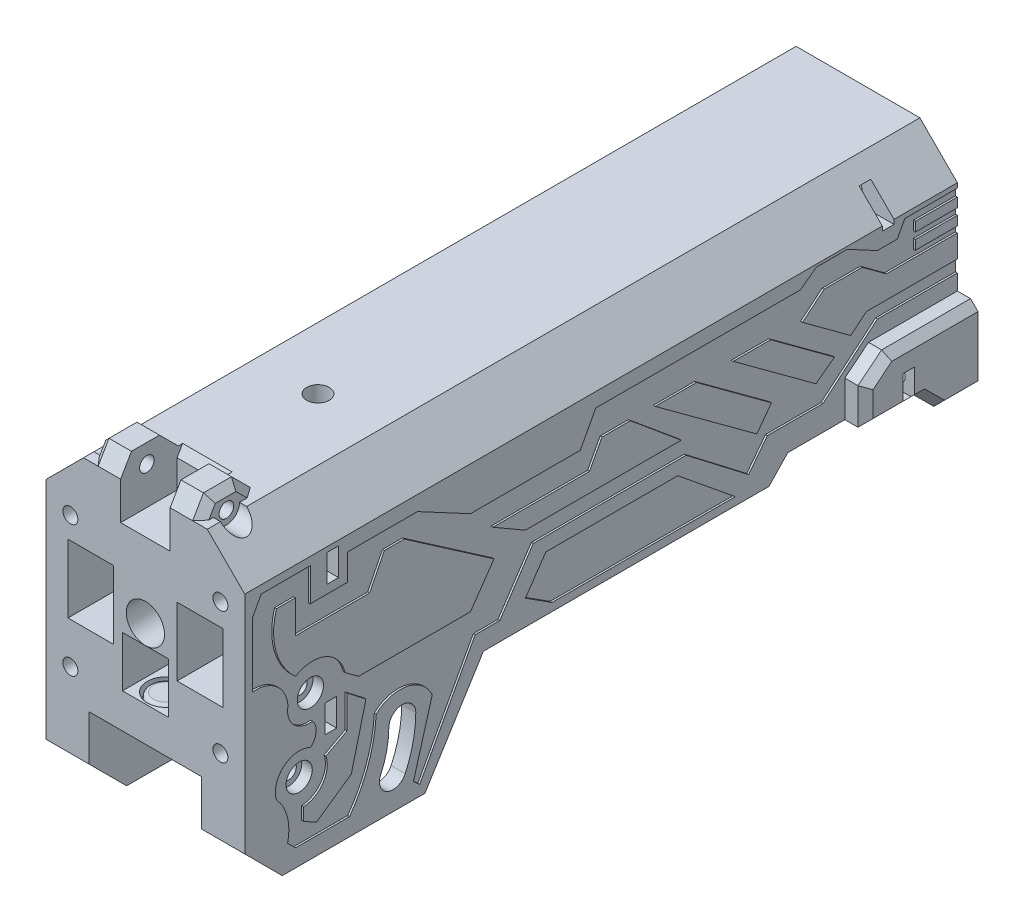
from build123d import *

# Parameters (mm, degrees)
EXTRUDE_2_DEPTH            = 26.5
SKETCH_6_R                 = 22.575
CUT_EXTRUDE_4_DEPTH        = 160
SKETCH_4_W                 = 160
SKETCH_4_H                 = 60
CUT_EXTRUDE_2_DEPTH        = 22.75
CUT_EXTRUDE_5_DEPTH        = 208.851509497
CUT_EXTRUDE_5_DEPTH_BACK   = 208.851509497
SKETCH_7_R                 = 2.05
CUT_EXTRUDE_6_DEPTH        = 15
CUT_EXTRUDE_8_REACH        = 214.859
CHAMFER_1_SIZE             = 10
CHAMFER_2_SIZE             = 10
CUT_EXTRUDE_15_DEPTH       = 208.851509497
CUT_EXTRUDE_15_DEPTH_BACK  = 208.851509497
SKETCH_18_R                = 1.95
CUT_EXTRUDE_14_DEPTH       = 6.1
SKETCH_19_R                = 5
SKETCH_19_R_2              = 4.3
CUT_EXTRUDE_16_DEPTH       = 3.5
FILLET_1_R                 = 1
CUT_EXTRUDE_17_REACH       = 182.838
SKETCH_20_W                = 12.2
SKETCH_20_H                = 18.2
SKETCH_13_R                = 3.5
CUT_EXTRUDE_9_DEPTH        = 3.3
CUT_EXTRUDE_10_DEPTH       = 3.5
SKETCH_28_R                = 2
CUT_EXTRUDE_20_DEPTH       = 26
CUT_EXTRUDE_21_DEPTH       = 3.1
EXTRUDE_3_DEPTH            = 5.5
CHAMFER_4_SIZE             = 2
CHAMFER_4_OF_MIRROR_2_SIZE = 2
SKETCH_31_R                = 2
CUT_EXTRUDE_22_DEPTH       = 21
CUT_EXTRUDE_23_DEPTH       = 3.1
CUT_EXTRUDE_24_DEPTH       = 0.5
CUT_EXTRUDE_25_DEPTH       = 0.5
SKETCH_36_R                = 2.05
CUT_EXTRUDE_26_DEPTH       = 209.624063809
SKETCH_37_R                = 5.1
CUT_EXTRUDE_27_DEPTH       = 21
CUT_EXTRUDE_28_DEPTH       = 12
SKETCH_39_R                = 3.55
CUT_EXTRUDE_29_DEPTH       = 7
CUT_EXTRUDE_30_DEPTH       = 0.5
CUT_EXTRUDE_31_DEPTH       = 6.6
EXTRUDE_4_DEPTH            = 8
CUT_EXTRUDE_32_DEPTH       = 209.624063809
CUT_EXTRUDE_32_DEPTH_BACK  = 209.624063809
SKETCH_44_R                = 1.95
SKETCH_45_R                = 3.5
CUT_EXTRUDE_33_DEPTH       = 212.356476125
CUT_EXTRUDE_34_DEPTH       = 212.356476125
SKETCH_47_R                = 3
CUT_EXTRUDE_35_DEPTH       = 5.1
CHAMFER_5_SIZE             = 2


with BuildPart() as part:
    # 스케치3 → 보스-돌출2 (new, symmetric)
    with BuildSketch(Plane(origin=(0, 0, 0), x_dir=(0, 0, -1), z_dir=(1, 0, 0))):
        Polygon((190, 0), (0, 0), (0, -80), (48.036620676, -80), (63.607235038, -55), (139.752067598, -55), (144.779832831, -49.713150114), (174.909439737, -49.713150114), (180.221497313, -55), (190, -55), align=None)
    extrude(amount=EXTRUDE_2_DEPTH, both=True)

    # 스케치6 → 컷-돌출4 (cut)
    with BuildSketch(Plane(origin=(0, 0, -190), x_dir=(-1, 0, 0), z_dir=(0, 0, -1))):
        with Locations((0, -30)):
            Circle(SKETCH_6_R)
    extrude(amount=-CUT_EXTRUDE_4_DEPTH, mode=Mode.SUBTRACT)

    # 스케치4 → 컷-돌출2 (cut, symmetric)
    with BuildSketch(Plane(origin=(0, 0, 0), x_dir=(0, 0, -1), z_dir=(1, 0, 0))):
        with Locations((110, -60)):
            Rectangle(SKETCH_4_W, SKETCH_4_H)
    extrude(amount=CUT_EXTRUDE_2_DEPTH, both=True, mode=Mode.SUBTRACT)

    # 스케치7 → 컷-돌출5 (cut, two sides: drawn at the far end of the back side and taken through both)
    with BuildSketch(Plane(origin=(0, 0, 0), x_dir=(0, 0, -1), z_dir=(1, 0, 0)).offset(-CUT_EXTRUDE_5_DEPTH_BACK)):
        with Locations((15, -60)):
            Circle(SKETCH_7_R)
    extrude(amount=CUT_EXTRUDE_5_DEPTH + CUT_EXTRUDE_5_DEPTH_BACK, mode=Mode.SUBTRACT)

    # 스케치8 → 컷-돌출6 (cut, symmetric)
    with BuildSketch(Plane(origin=(0, 0, 0), x_dir=(0, 0, -1), z_dir=(1, 0, 0))):
        with BuildLine():
            Line((13.063174249, -51.62), (100, -51.62))
            Line((100, -51.62), (100, -86.62))
            Line((100, -86.62), (0, -86.62))
            Line((0, -86.62), (0, -57.901037115))
            Line((0, -57.901037115), (7.084319138, -57.901037115))
            ThreePointArc((7.084319138, -57.901037115), (9.26885551, -53.994350856), (13.063174249, -51.62))
        make_face()
    extrude(amount=CUT_EXTRUDE_6_DEPTH, both=True, mode=Mode.SUBTRACT)

    # 스케치11 → 컷-돌출8 (cut, up to next)
    with BuildSketch(Plane(origin=(26.5, 0, 0), x_dir=(0, 0, -1), z_dir=(1, 0, 0)), mode=Mode.PRIVATE) as cut_extrude_8_sk1:
        with BuildLine():
            ThreePointArc((42.784600889, -72.820918586), (44.875641998, -66.618611273), (45.59997467, -60.113504732))
            ThreePointArc((45.59997467, -60.113504732), (42.013504732, -56.50002533), (38.40002533, -60.086495268))
            ThreePointArc((38.40002533, -60.086495268), (37.846101333, -65.061190959), (36.247004819, -69.804324875))
            ThreePointArc((36.247004819, -69.804324875), (38.007505998, -74.581419766), (42.784600889, -72.820918586))
        make_face()
    cut_extrude_8_tool1 = extrude(cut_extrude_8_sk1.sketch, amount=-CUT_EXTRUDE_8_REACH, mode=Mode.PRIVATE) & part.part
    cut_extrude_8 = cut_extrude_8_tool1.solids().sort_by_distance((26.5, -65.766092, -41.027728))[0]
    add(cut_extrude_8, mode=Mode.SUBTRACT)

    # 대칭 복사1: 컷-돌출8 across plane
    add(cut_extrude_8.mirror(Plane(origin=(0, 0, 0), x_dir=(0, 0, 1), z_dir=(1, 0, 0))), mode=Mode.SUBTRACT)

    # 모따기1
    chamfer_1_edges = [part.edges().sort_by_distance(p)[0] for p in [
        (20.75, -80, 0),
        (-20.75, -80, 0),
    ]]
    chamfer(chamfer_1_edges, length=CHAMFER_1_SIZE)

    # 모따기2
    chamfer_2_edges = [part.edges().sort_by_distance(p)[0] for p in [
        (-26.5, 0, -95),
        (26.5, 0, -95),
    ]]
    chamfer(chamfer_2_edges, length=CHAMFER_2_SIZE)

    # 스케치18 → 컷-돌출15 (cut, two sides: drawn at the far end of the back side and taken through both)
    with BuildSketch(Plane(origin=(0, 0, 0), x_dir=(0, 0, -1), z_dir=(1, 0, 0)).offset(-CUT_EXTRUDE_15_DEPTH_BACK)):
        with Locations((18, -42)):
            Circle(SKETCH_18_R)
    extrude(amount=CUT_EXTRUDE_15_DEPTH + CUT_EXTRUDE_15_DEPTH_BACK, mode=Mode.SUBTRACT)

    # 스케치17 → 컷-돌출14 (cut, symmetric)
    with BuildSketch(Plane(origin=(0, 0, 0), x_dir=(0, 0, -1), z_dir=(1, 0, 0))):
        Polygon((30, -35.12), (30, -32.2), (27.763329456, -32.2), (24.559812542, -35.12), (0, -35.12), (0, -48.62), (23.648749147, -48.62), (23.648749147, -51.62), (30, -51.62), (30, -46.064452086), align=None)
    extrude(amount=CUT_EXTRUDE_14_DEPTH, both=True, mode=Mode.SUBTRACT)

    # 스케치19 → 컷-돌출16 (cut)
    with BuildSketch(Plane(origin=(0, -48.62, 0), x_dir=(1, 0, 0), z_dir=(0, 1, 0))):
        with Locations((0, 5.5)):
            Circle(SKETCH_19_R)
        with Locations((0, 5.5)):
            Circle(SKETCH_19_R_2, mode=Mode.SUBTRACT)
    extrude(amount=-CUT_EXTRUDE_16_DEPTH, mode=Mode.SUBTRACT)

    # 필렛1
    fillet_1_edges = [part.edges().sort_by_distance(p)[0] for p in [
        (-4.3, -48.62, -5.5),
    ]]
    fillet(fillet_1_edges, radius=FILLET_1_R)

    # 스케치20 → 컷-돌출17 (cut, up to next)
    with BuildSketch(Plane(origin=(0, 0, -30), x_dir=(-1, 0, 0), z_dir=(0, 0, -1)), mode=Mode.PRIVATE) as cut_extrude_17_sk1:
        with Locations((-14.546948254, -29.971245825)):
            Rectangle(SKETCH_20_W, SKETCH_20_H)
    cut_extrude_17_tool1 = extrude(cut_extrude_17_sk1.sketch, amount=-CUT_EXTRUDE_17_REACH, mode=Mode.PRIVATE) & part.part
    # 스케치20 → 컷-돌출17 (cut, up to next)
    with BuildSketch(Plane(origin=(0, 0, -30), x_dir=(-1, 0, 0), z_dir=(0, 0, -1)), mode=Mode.PRIVATE) as cut_extrude_17_sk2:
        with Locations((14.546948254, -29.971245825)):
            Rectangle(SKETCH_20_W, SKETCH_20_H)
    cut_extrude_17_tool2 = extrude(cut_extrude_17_sk2.sketch, amount=-CUT_EXTRUDE_17_REACH, mode=Mode.PRIVATE) & part.part
    add(cut_extrude_17_tool1.solids().sort_by_distance((14.546948, -29.971246, -30))[0], mode=Mode.SUBTRACT)
    add(cut_extrude_17_tool2.solids().sort_by_distance((-14.546948, -29.971246, -30))[0], mode=Mode.SUBTRACT)

    # 스케치13 → 컷-돌출9 (cut)
    with BuildSketch(Plane(origin=(26.5, 0, 0), x_dir=(0, 0, -1), z_dir=(1, 0, 0))):
        with Locations((15, -60)):
            Circle(SKETCH_13_R)
        with Locations((18, -42)):
            Circle(SKETCH_13_R)
    extrude(amount=-CUT_EXTRUDE_9_DEPTH, mode=Mode.SUBTRACT)

    # 스케치14 → 컷-돌출10 (cut)
    with BuildSketch(Plane.ZY.offset(26.5)):
        Polygon((-10.785343035, -60), (-12.892671517, -56.35), (-17.107328483, -56.35), (-19.214656965, -60), (-17.107328483, -63.65), (-12.892671517, -63.65), align=None)
        Polygon((-13.785343035, -42), (-15.892671517, -38.35), (-20.107328483, -38.35), (-22.214656965, -42), (-20.107328483, -45.65), (-15.892671517, -45.65), align=None)
    extrude(amount=-CUT_EXTRUDE_10_DEPTH, mode=Mode.SUBTRACT)

    # 스케치28 → 컷-돌출20 (cut)
    with BuildSketch(Plane.XY):
        with Locations((-20, -15)):
            Circle(SKETCH_28_R)
        with Locations((-20, -50)):
            Circle(SKETCH_28_R)
        with Locations((20, -50)):
            Circle(SKETCH_28_R)
        with Locations((20, -15)):
            Circle(SKETCH_28_R)
    extrude(amount=-CUT_EXTRUDE_20_DEPTH, mode=Mode.SUBTRACT)

    # 스케치30 → 컷-돌출21 (cut)
    with BuildSketch(Plane.XY.offset(-25)):
        Polygon((-17.878237761, -18.675), (-15.756475521, -15), (-17.878237761, -11.325), (-32.606859232, -11.325), (-32.606859232, -18.675), align=None)
        Polygon((-17.878237761, -53.675), (-15.756475521, -50), (-17.878237761, -46.325), (-32.606859232, -46.325), (-32.606859232, -53.675), align=None)
        Polygon((32.606859232, -53.675), (32.606859232, -46.325), (17.878237761, -46.325), (15.756475521, -50), (17.878237761, -53.675), align=None)
        Polygon((32.606859232, -18.675), (32.606859232, -11.325), (17.878237761, -11.325), (15.756475521, -15), (17.878237761, -18.675), align=None)
    extrude(amount=CUT_EXTRUDE_21_DEPTH, mode=Mode.SUBTRACT)

    # 스케치32 → 보스-돌출3 (add)
    with BuildSketch(Plane(origin=(26.5, 0, 0), x_dir=(0, 0, -1), z_dir=(1, 0, 0))):
        Polygon((190, -35), (166.300380468, -35), (160, -40.097186501), (160, -49.713150114), (174.909439737, -49.713150114), (180.221497313, -55), (190, -55), align=None)
    extrude_3 = extrude(amount=EXTRUDE_3_DEPTH)

    # 모따기4
    chamfer_4_edges = [part.edges().sort_by_distance(p)[0] for p in [
        (32, -35, -178.150190234),
        (32, -37.548593251, -163.150190234),
        (32, -55, -185.110748657),
        (32, -52.356575057, -177.565468525),
        (32, -49.713150114, -167.454719868),
        (32, -44.905168308, -160),
    ]]
    chamfer(chamfer_4_edges, length=CHAMFER_4_SIZE)

    # 대칭 복사2: 보스-돌출3 across plane
    add(extrude_3.mirror(Plane(origin=(0, 0, 0), x_dir=(0, 0, 1), z_dir=(1, 0, 0))))

    # 모따기4 of 대칭 복사2
    chamfer_4_of_mirror_2_edges = [part.edges().sort_by_distance(p)[0] for p in [
        (-32, -35, -178.150190234),
        (-32, -37.548593251, -163.150190234),
        (-32, -55, -185.110748657),
        (-32, -52.356575057, -177.565468525),
        (-32, -49.713150114, -167.454719868),
        (-32, -44.905168308, -160),
    ]]
    chamfer(chamfer_4_of_mirror_2_edges, length=CHAMFER_4_OF_MIRROR_2_SIZE)

    # 스케치31 → 컷-돌출22 (cut)
    with BuildSketch(Plane(origin=(0, 0, -190), x_dir=(-1, 0, 0), z_dir=(0, 0, -1))):
        with Locations((-16, -7.5)):
            Circle(SKETCH_31_R)
        with Locations((16, -7.5)):
            Circle(SKETCH_31_R)
        with Locations((-27.5, -45)):
            Circle(SKETCH_31_R)
        with Locations((27.5, -45)):
            Circle(SKETCH_31_R)
    extrude(amount=-CUT_EXTRUDE_22_DEPTH, mode=Mode.SUBTRACT)

    # 스케치33 → 컷-돌출23 (cut)
    with BuildSketch(Plane(origin=(0, 0, -170), x_dir=(-1, 0, 0), z_dir=(0, 0, -1))):
        Polygon((-30.148229803, -11.175), (-13.878237761, -11.175), (-11.756475521, -7.5), (-13.878237761, -3.825), (-30.148229803, -3.825), align=None)
        Polygon((-25.378237761, -48.675), (-23.256475521, -45), (-25.378237761, -41.325), (-34.856665982, -41.325), (-34.856665982, -48.675), align=None)
        Polygon((34.856665982, -48.675), (34.856665982, -41.325), (25.378237761, -41.325), (23.256475521, -45), (25.378237761, -48.675), align=None)
        Polygon((30.148229803, -11.175), (30.148229803, -3.825), (13.878237761, -3.825), (11.756475521, -7.5), (13.878237761, -11.175), align=None)
    extrude(amount=CUT_EXTRUDE_23_DEPTH, mode=Mode.SUBTRACT)

    # 스케치34 → 컷-돌출24 (cut)
    with BuildSketch(Plane.ZY.offset(-20.646948254)):
        with BuildLine():
            Line((-27.5, -22.85), (-24, -22.85))
            ThreePointArc((-24, -22.85), (-21.85, -25), (-24, -27.15))
            Line((-24, -27.15), (-27.5, -27.15))
            ThreePointArc((-27.5, -27.15), (-29.65, -25), (-27.5, -22.85))
        make_face()
    extrude(amount=-CUT_EXTRUDE_24_DEPTH, mode=Mode.SUBTRACT)

    # 스케치35 → 컷-돌출25 (cut)
    # profile 1 of 2: a face of its own
    with BuildSketch(Plane(origin=(26.5, 0, 0), x_dir=(0, 0, -1), z_dir=(1, 0, 0))):
        with BuildLine():
            Line((17.458831665, -12.160523948), (4.378802929, -12.160523948))
            Line((4.378802929, -12.160523948), (2.122470906, -16.379974903))
            Line((2.122470906, -16.379974903), (2.122470906, -33.602690717))
            ThreePointArc((2.122470906, -33.602690717), (8.455398453, -35.588453707), (11.529307991, -41.470656197))
            ThreePointArc((11.529307991, -41.470656197), (13.004511937, -46.612931153), (18.069322359, -48.335404317))
            ThreePointArc((18.069322359, -48.335404317), (19.011457273, -51.3728326), (17.529861123, -54.186808723))
            ThreePointArc((17.529861123, -54.186808723), (10.457210363, -54.907657926), (8.455398453, -61.72929713))
            ThreePointArc((8.455398453, -61.72929713), (11.357052946, -67.10469954), (11.411441379, -73.213021057))
            Line((11.411441379, -73.213021057), (13.525371852, -75.32695153))
            Line((13.525371852, -75.32695153), (27.938798587, -75.32695153))
            ThreePointArc((27.938798587, -75.32695153), (32.962394589, -65.784164203), (35.037112477, -55.201307668))
            ThreePointArc((35.037112477, -55.201307668), (43.267375884, -52.926880167), (49.989762299, -58.191837632))
            Line((49.989762299, -58.191837632), (44.975035239, -75.758036386))
            Line((44.975035239, -75.758036386), (46.640861492, -77.244005614))
            Line((46.640861492, -77.244005614), (61.434671091, -50.070400221))
            Line((61.434671091, -50.070400221), (68.004179782, -50.070400221))
            Line((68.004179782, -50.070400221), (76.914058611, -36.746452982))
            Line((76.914058611, -36.746452982), (117.656789337, -36.746452982))
            Line((117.656789337, -36.746452982), (134.336461626, -49.559372494))
            Line((134.336461626, -49.559372494), (139.326592855, -43.063292229))
            Line((139.326592855, -43.063292229), (154.151986518, -43.063292229))
            Line((154.151986518, -43.063292229), (168.671167773, -30.814725007))
            Line((168.671167773, -30.814725007), (190, -30.814725007))
            Line((190, -30.814725007), (190, -27.60874054))
            Line((190, -27.60874054), (165.744548794, -27.60874054))
            Line((165.744548794, -27.60874054), (161.571298193, -31.053017363))
            Line((161.571298193, -31.053017363), (148.688814421, -21.587332035))
            Line((148.688814421, -21.587332035), (154.45905488, -16.825023854))
            Line((154.45905488, -16.825023854), (164.597850619, -16.825023854))
            Line((164.597850619, -16.825023854), (171.079194096, -21.587332035))
            Line((171.079194096, -21.587332035), (190, -21.587332035))
            Line((190, -21.587332035), (190, -19.996853886))
            Line((190, -19.996853886), (178.789702893, -19.996853886))
            Line((178.789702893, -19.996853886), (178.789702893, -17.496853886))
            Line((178.789702893, -17.496853886), (190, -17.496853886))
            Line((190, -17.496853886), (190, -15.794121348))
            Line((190, -15.794121348), (178.789702893, -15.794121348))
            Line((178.789702893, -15.794121348), (178.789702893, -13.294121348))
            Line((178.789702893, -13.294121348), (190, -13.294121348))
            Line((190, -13.294121348), (190, -11.253065409))
            Line((190, -11.253065409), (175.984546066, -11.253065409))
            Line((175.984546066, -11.253065409), (173.98588805, -14.990653399))
            Line((173.98588805, -14.990653399), (168.671167773, -14.990653399))
            Line((168.671167773, -14.990653399), (160.650273963, -10.701517265))
            Line((160.650273963, -10.701517265), (152.37388598, -10.701517265))
            Line((152.37388598, -10.701517265), (148.176153118, -13.804356098))
            Line((148.176153118, -13.804356098), (93.574627764, -13.804356098))
            Line((93.574627764, -13.804356098), (89.4551867, -21.507911847))
            Line((89.4551867, -21.507911847), (60.174947828, -21.507911847))
            Line((60.174947828, -21.507911847), (46.030370799, -13.94416423))
            Line((46.030370799, -13.94416423), (27.328307893, -13.94416423))
            Line((27.328307893, -13.94416423), (27.328307893, -20.959816007))
            Line((27.328307893, -20.959816007), (17.458831665, -20.959816007))
            Line((17.458831665, -20.959816007), (17.458831665, -12.160523948))
        make_face()
        with BuildLine():
            ThreePointArc((15.65439014, -66.896059897), (20.837637409, -64.048685396), (21.6567394, -58.191837632))
            Line((21.6567394, -58.191837632), (27.254435901, -55.201307668))
            Line((27.254435901, -55.201307668), (27.254435901, -46.461095562))
            Line((27.254435901, -46.461095562), (32.31259539, -50.3727389))
            Line((32.31259539, -50.3727389), (28.400952052, -65.749543746))
            Line((28.400952052, -65.749543746), (19.093938593, -72.223987892))
            Line((19.093938593, -72.223987892), (15.65439014, -70.268541258))
            Line((15.65439014, -70.268541258), (15.65439014, -66.896059897))
        make_face(mode=Mode.SUBTRACT)
        with BuildLine():
            ThreePointArc((13.525371852, -35.746377283), (8.322065536, -27.415840726), (8.455398453, -17.59471766))
            Line((8.455398453, -17.59471766), (13.525371852, -17.59471766))
            Line((13.525371852, -17.59471766), (13.525371852, -26.371762742))
            Line((13.525371852, -26.371762742), (33.293222093, -26.371762742))
            Line((33.293222093, -26.371762742), (37.199922863, -18.533520121))
            Line((37.199922863, -18.533520121), (42.516028771, -18.533520121))
            Line((42.516028771, -18.533520121), (66.447878897, -35.070881605))
            Line((66.447878897, -35.070881605), (60.174947828, -44.148680764))
            Line((60.174947828, -44.148680764), (30.353617403, -44.148680764))
            Line((30.353617403, -44.148680764), (26.720680945, -41.470656197))
            ThreePointArc((26.720680945, -41.470656197), (21.597849513, -35.208831444), (13.525371852, -35.746377283))
        make_face(mode=Mode.SUBTRACT)
        Polygon((91.906717529, -27.60874054), (95.254446812, -21.348323465), (102.800122341, -21.348323465), (116.371526716, -32.629568435), (74.810227166, -32.629568435), (66.134515899, -27.60874054), align=None, mode=Mode.SUBTRACT)
        Polygon((136.542351043, -41.278345533), (109.418252051, -21.348323465), (120.451700713, -21.348323465), (140.410708745, -36.013639008), align=None, mode=Mode.SUBTRACT)
        Polygon((152.285252252, -37.556338271), (130.226681691, -21.348323465), (140.183676116, -21.348323465), (157.224116099, -33.869157614), align=None, mode=Mode.SUBTRACT)
    # profile 2 of 2: a face of its own
    with BuildSketch(Plane(origin=(26.5, 0, 0), x_dir=(0, 0, -1), z_dir=(1, 0, 0))):
        Polygon((80.282338644, -40.374805177), (74.810227166, -48.335404317), (81.921647565, -52.876203638), (130.78978522, -52.876203638), (115.463574135, -40.374805177), align=None)
    cut_extrude_25 = extrude(amount=-CUT_EXTRUDE_25_DEPTH, mode=Mode.SUBTRACT)

    # 대칭 복사3: 컷-돌출25 across plane
    add(cut_extrude_25.mirror(Plane(origin=(0, 0, 0), x_dir=(0, 0, 1), z_dir=(1, 0, 0))), mode=Mode.SUBTRACT)

    # 스케치36 → 컷-돌출26 (cut, through all)
    with BuildSketch(Plane.XY):
        with Locations((0, -30)):
            Circle(SKETCH_36_R)
    extrude(amount=-CUT_EXTRUDE_26_DEPTH, mode=Mode.SUBTRACT)

    # 스케치37 → 컷-돌출27 (cut)
    with BuildSketch(Plane.XY):
        with Locations((0, -30)):
            Circle(SKETCH_37_R)
    extrude(amount=-CUT_EXTRUDE_27_DEPTH, mode=Mode.SUBTRACT)

    # 스케치38 → 컷-돌출28 (cut, symmetric)
    with BuildSketch(Plane(origin=(0, 0, 0), x_dir=(0, 0, -1), z_dir=(1, 0, 0))):
        with BuildLine():
            Line((23.9, -32.4), (27.7, -32.4))
            ThreePointArc((27.7, -32.4), (29.8, -34.5), (27.7, -36.6))
            Line((27.7, -36.6), (23.9, -36.6))
            ThreePointArc((23.9, -36.6), (21.8, -34.5), (23.9, -32.4))
        make_face()
    extrude(amount=CUT_EXTRUDE_28_DEPTH, both=True, mode=Mode.SUBTRACT)

    # 스케치39 → 컷-돌출29 (cut)
    with BuildSketch(Plane.ZY.offset(26.5)):
        with Locations((-23.9, -34.5)):
            Circle(SKETCH_39_R)
    extrude(amount=-CUT_EXTRUDE_29_DEPTH, mode=Mode.SUBTRACT)

    # 스케치40 → 컷-돌출30 (cut)
    with BuildSketch(Plane.ZY.offset(26.5)):
        with BuildLine():
            ThreePointArc((-19.738993236, -34.635939604), (-21.403919005, -38.361805697), (-25.482838679, -38.490142192))
            ThreePointArc((-25.482838679, -38.490142192), (-26.606851173, -30.607973993), (-19.738993236, -34.635939604))
        make_face()
    extrude(amount=-CUT_EXTRUDE_30_DEPTH, mode=Mode.SUBTRACT)

    # 스케치41 → 컷-돌출31 (cut, symmetric)
    with BuildSketch(Plane(origin=(0, 0, 0), x_dir=(0, 0, -1), z_dir=(1, 0, 0))):
        Polygon((15, 0), (16.533983066, 0), (15.05, -2.570334068), (15.05, -10.03), (0, -10.03), (0, 0), align=None)
    extrude(amount=CUT_EXTRUDE_31_DEPTH, both=True, mode=Mode.SUBTRACT)

    # 스케치43 → 보스-돌출4 (add)
    with BuildSketch(Plane(origin=(-6.6, 0, 0), x_dir=(0, 0, -1), z_dir=(1, 0, 0))):
        Polygon((0, 0), (2.886751346, 5), (10.356051128, 5), (15.356051128, 0), align=None)
    extrude_4 = extrude(amount=-EXTRUDE_4_DEPTH)

    # 대칭 복사4: 보스-돌출4 across plane
    add(extrude_4.mirror(Plane(origin=(0, 0, 0), x_dir=(0, 0, 1), z_dir=(1, 0, 0))))

    # 스케치44 → 컷-돌출32 (cut, two sides: drawn at the far end of the back side and taken through both)
    with BuildSketch(Plane(origin=(0, 0, 0), x_dir=(0, 0, -1), z_dir=(1, 0, 0)).offset(-CUT_EXTRUDE_32_DEPTH_BACK)):
        with Locations((7, 0)):
            Circle(SKETCH_44_R)
    extrude(amount=CUT_EXTRUDE_32_DEPTH + CUT_EXTRUDE_32_DEPTH_BACK, mode=Mode.SUBTRACT)

    # 스케치45 → 컷-돌출33 (cut, through all)
    with BuildSketch(Plane(origin=(14.6, 0, 0), x_dir=(0, 0, -1), z_dir=(1, 0, 0))):
        with Locations((7, 0)):
            Circle(SKETCH_45_R)
    extrude(amount=CUT_EXTRUDE_33_DEPTH, mode=Mode.SUBTRACT)

    # 스케치46 → 컷-돌출34 (cut, through all)
    with BuildSketch(Plane.ZY.offset(14.6)):
        Polygon((-2.785343035, 0), (-4.892671517, 3.65), (-9.107328483, 3.65), (-11.214656965, 0), (-9.107328483, -3.65), (-4.892671517, -3.65), align=None)
    extrude(amount=CUT_EXTRUDE_34_DEPTH, mode=Mode.SUBTRACT)

    # 스케치47 → 컷-돌출35 (cut)
    with BuildSketch(Plane(origin=(0, 0, 0), x_dir=(1, 0, 0), z_dir=(0, 1, 0))):
        with Locations((0, 46.015)):
            Circle(SKETCH_47_R)
    extrude(amount=-CUT_EXTRUDE_35_DEPTH, mode=Mode.SUBTRACT)

    # 모따기5
    chamfer_5_edges = [part.edges().sort_by_distance(p)[0] for p in [
        (-14.6, 2.5, -12.856051128),
        (-14.6, 5, -6.621401237),
        (-14.6, 2.5, -1.443375673),
        (14.6, 2.5, -12.856051128),
        (14.6, 5, -6.621401237),
        (14.6, 2.5, -1.443375673),
    ]]
    chamfer(chamfer_5_edges, length=CHAMFER_5_SIZE)


solid = part.part
